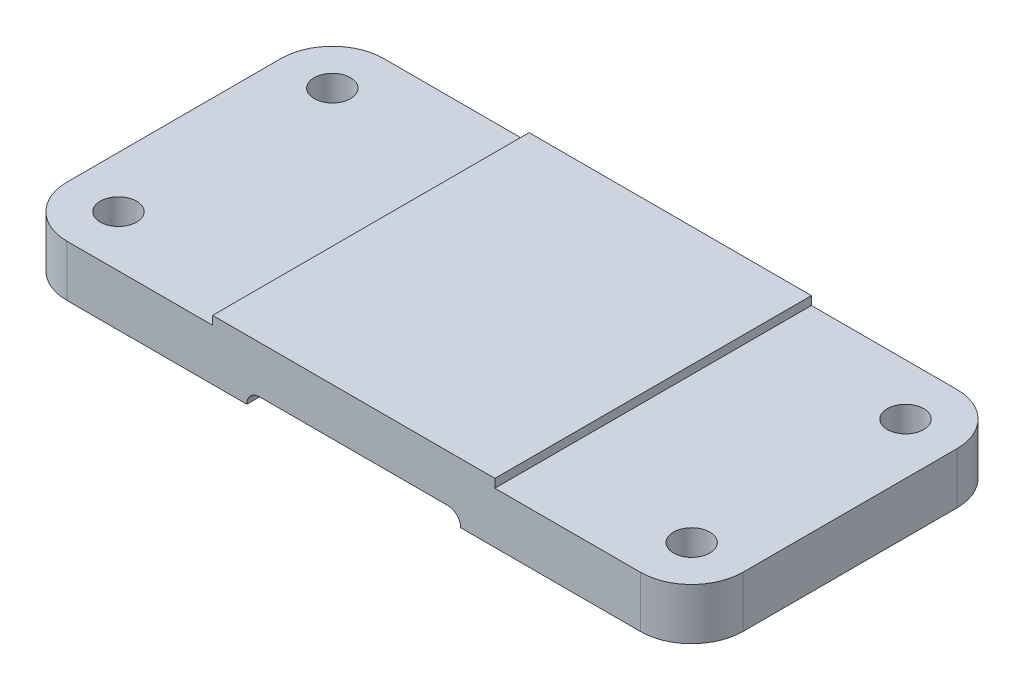
from build123d import *

# Parameters (mm, degrees)
BOSS_EXTRUDE2_DEPTH              = 12
BOSS_EXTRUDE3_DEPTH              = 2
CUT_EXTRUDE1_DEPTH               = 3
FILLET1_R                        = 3
TAP_DRILL_FOR_M10X1_5_TAP1_D     = 8.5
TAP_DRILL_FOR_M10X1_5_TAP1_DEPTH = 12.55
TAP_DRILL_FOR_M10X1_5_TAP1_TIP   = 4.25


with BuildPart() as part:
    # Sketch2 → Boss-Extrude2 (new body)
    with BuildSketch(Plane(origin=(0, 0, 0), x_dir=(1, 0, 0), z_dir=(0, 1, 0))):
        with BuildLine():
            Line((12, 0), (146, 0))
            ThreePointArc((146, 0), (154.485281374, 3.514718626), (158, 12))
            Line((158, 12), (158, 62))
            ThreePointArc((158, 62), (154.485281374, 70.485281374), (146, 74))
            Line((146, 74), (12, 74))
            ThreePointArc((12, 74), (3.514718626, 70.485281374), (0, 62))
            Line((0, 62), (0, 12))
            ThreePointArc((0, 12), (3.514718626, 3.514718626), (12, 0))
        make_face()
    extrude(amount=BOSS_EXTRUDE2_DEPTH)

    # 3DSketch2 → Boss-Extrude3 (add)
    with BuildSketch(Plane(origin=(112, 12, 0), x_dir=(-0.6656148469584017, 0, -0.7462954344685109), z_dir=(0, -1, 0))):
        Polygon((0, 0), (55.225862151, 49.255498675), (99.15644205, 0), (43.930579899, -49.255498675), align=None)
    extrude(amount=-BOSS_EXTRUDE3_DEPTH)

    # 3DSketch3 → Cut-Extrude1 (cut)
    with BuildSketch(Plane(origin=(104, 0, -74), x_dir=(-0.5598574112779868, 0, 0.8285889686914202), z_dir=(0, -1, 0))):
        Polygon((0, 0), (61.315583683, -41.429448435), (89.308454247, 0), (27.992870564, 41.429448435), align=None)
    extrude(amount=-CUT_EXTRUDE1_DEPTH, mode=Mode.SUBTRACT)

    # Fillet1
    fillet1_edges = [part.edges().sort_by_distance(p)[0] for p in [
        (104, 3, -37),
        (54, 3, -37),
    ]]
    fillet(fillet1_edges, radius=FILLET1_R - 0.0001)  # a hair under: the kernel refuses the full size

    # Tap Drill for M10x1.5 Tap1
    with Locations(Plane(origin=(0, 12, 0), x_dir=(1, 0, 0), z_dir=(0, 1, 0))):
        with Locations((146, 12), (146, 62), (12, 12), (12, 62)):
            Hole(TAP_DRILL_FOR_M10X1_5_TAP1_D / 2, depth=TAP_DRILL_FOR_M10X1_5_TAP1_DEPTH)
            with Locations((0, 0, -(TAP_DRILL_FOR_M10X1_5_TAP1_DEPTH + TAP_DRILL_FOR_M10X1_5_TAP1_TIP / 2))):  # 90° drill point
                Cone(0, TAP_DRILL_FOR_M10X1_5_TAP1_D / 2, TAP_DRILL_FOR_M10X1_5_TAP1_TIP, mode=Mode.SUBTRACT)


solid = part.part
